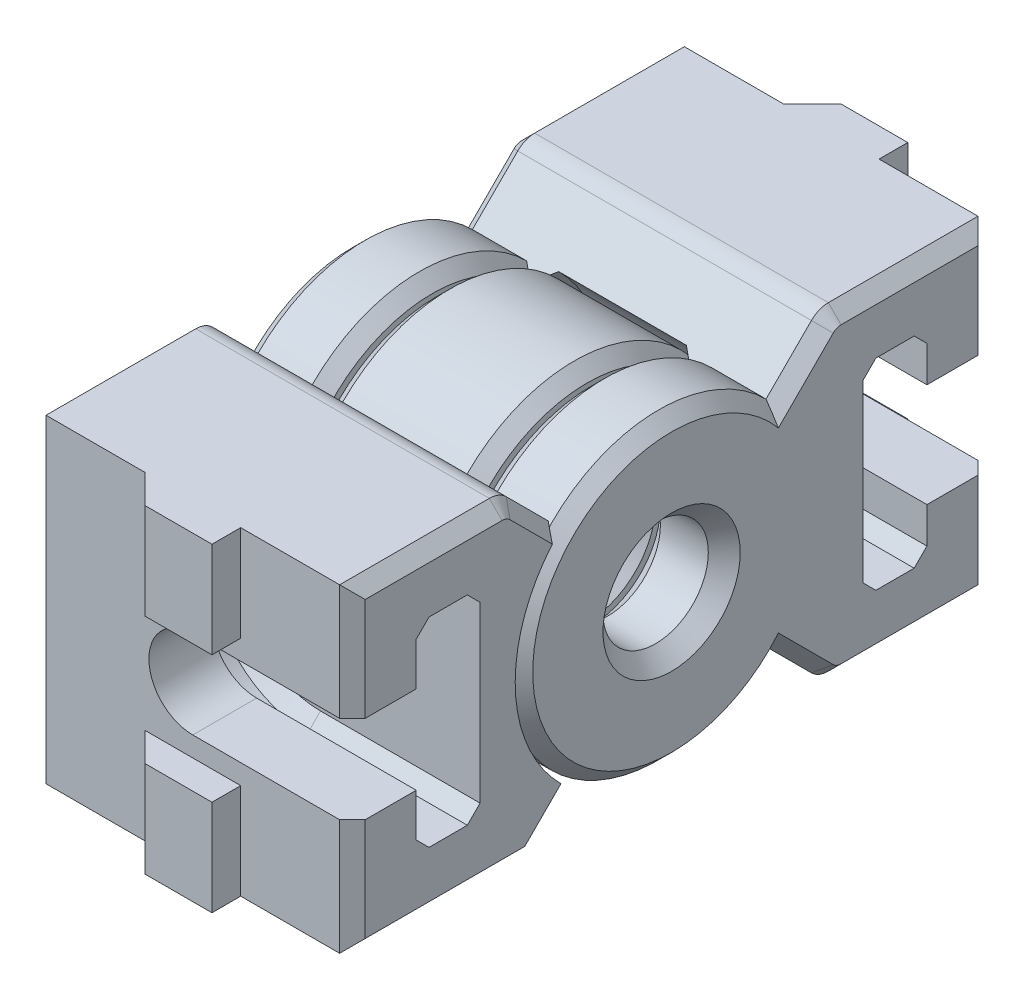
from build123d import *
from build123d.topology import SkipClean

# Parameters (mm, degrees)
SK_CYLINDER_W        = 20
SK_CYLINDER_H        = 6.2
BOSS_FIXEDSIDE_DEPTH = 10
SK_GAP_VERTICAL_W    = 10
SK_GAP_VERTICAL_H    = 0.3
SK_GAP_VERTICAL_W_2  = 5.3
GAPS_VERTICAL_ANGLE  = 180
SK_GAP_HORIZONTAL_W  = 0.3
SK_GAP_HORIZONTAL_H  = 9.8
CHAMF_ARMS_EXT_SIZE  = 1
CHAMF_ARMS_INT_SIZE  = 1
SK_BODYFIXED_W       = 5.715659497
SK_BODYFIXED_H       = 20
BODY_FIXED_DEPTH     = 10
FILLET_VERT_R        = 1.5
CHAMF_FACES1_SIZE    = 0.8
TAB_F_DEPTH          = 5
CHAMF_BODY_F_ANGLE   = 270
CHAMF_BODY_P_SIZE    = 0.8
CHAMF_F2_SIZE        = 1
CHAMF_P2_SIZE        = 1
SK_BODY_P_W          = 20
SK_BODY_P_H          = 5.715659497
PIVOT_BODY_DEPTH     = 10
FILLET_VERT2_R       = 1.5
TAB_P_DEPTH          = 6
CHAMF_FACES_SIZE     = 0.8
ACCESS_F_DEPTH       = 10
ACCESS_P_DEPTH       = 10
CHAMF_SCREW_F_SIZE   = 0.8
CHAMF_SCREW_P_SIZE   = 0.8
VERSION_NO_START     = -0.5
VERSION_NO_DEPTH     = 0.5
LABEL_S_DEPTH        = 0.5


with BuildPart() as part:
    # sk_cylinder → cylinder1 (revolve)
    with BuildSketch(Plane.XY, mode=Mode.PRIVATE) as cylinder1_sk:
        with Locations((0, 6.4)):
            Rectangle(SK_CYLINDER_W, SK_CYLINDER_H)
    revolve(cylinder1_sk.sketch.rotate(Axis((38.374012803, 0, 0), (-1, 0, 0)), 90), axis=Axis((38.374012803, 0, 0), (-1, 0, 0)))

    # sk_boss → Boss_fixedSide (add, symmetric)
    with BuildSketch(Plane(origin=(0, 0, 0), x_dir=(0, 0, -1), z_dir=(1, 0, 0))):
        with BuildLine():
            Line((-10, 10), (-14.284340503, 10))
            Line((-14.284340503, 10), (-14.284340503, -10))
            Line((-14.284340503, -10), (-10, -10))
            Line((-10, -10), (-6.717514421, -6.717514421))
            ThreePointArc((-6.717514421, -6.717514421), (-9.5, 0), (-6.717514421, 6.717514421))
            Line((-6.717514421, 6.717514421), (-10, 10))
        make_face()
    boss_fixedside = extrude(amount=BOSS_FIXEDSIDE_DEPTH, both=True)

    # Mirror1: Boss_fixedSide across plane
    add(boss_fixedside.mirror(Plane.XY))

    # sk_gap_vertical → gaps_vertical (revolve, symmetric, cut)
    with SkipClean():  # the faces are left unmerged after this step: merging them gives an invalid solid
        with BuildSketch(Plane(origin=(0, 0, 0), x_dir=(1, 0, 0), z_dir=(0, 1, 0))) as gaps_vertical_sk:
            with Locations((0, 9.65)):
                Rectangle(SK_GAP_VERTICAL_W, SK_GAP_VERTICAL_H)
            with Locations((-7.35, -9.65)):
                Rectangle(SK_GAP_VERTICAL_W_2, SK_GAP_VERTICAL_H)
            with Locations((7.35, -9.65)):
                Rectangle(SK_GAP_VERTICAL_W_2, SK_GAP_VERTICAL_H)
        revolve(axis=Axis((38.374012803, 0, 0), (-1, 0, 0)), revolution_arc=GAPS_VERTICAL_ANGLE / 2, mode=Mode.SUBTRACT)
        revolve(gaps_vertical_sk.sketch, axis=Axis((38.374012803, 0, 0), (1, 0, 0)), revolution_arc=GAPS_VERTICAL_ANGLE / 2, mode=Mode.SUBTRACT)
    add(part.part.scale(1), mode=Mode.REPLACE)  # the faces are merged on a copy

    # sk_gap_horizontal → gaps_horizontal (revolve, cut)
    with BuildSketch(Plane(origin=(0, 0, 0), x_dir=(1, 0, 0), z_dir=(0, 1, 0))):
        with Locations((-4.85, 4.9)):
            Rectangle(SK_GAP_HORIZONTAL_W, SK_GAP_HORIZONTAL_H)
        with Locations((4.85, 4.9)):
            Rectangle(SK_GAP_HORIZONTAL_W, SK_GAP_HORIZONTAL_H)
    revolve(axis=Axis((38.374012803, 0, 0), (-1, 0, 0)), mode=Mode.SUBTRACT)


with BuildPart() as gaps_horizontal_piece_1:
    # of the separate pieces the step leaves, piece 1, a body of its own (gaps_horizontal_pieces)
    add(part.part.solids().sort_by_distance((-10, 6.717514421, -6.717514421))[0])

    # chamf_arms_ext
    chamf_arms_ext_edges = [gaps_horizontal_piece_1.edges().sort_by_distance(p)[0] for p in [
        (-5, 0, 3.3),
        (5, 0, 3.3),
        (10, 0, 3.3),
        (-10, 0, 3.3),
    ]]
    chamfer(chamf_arms_ext_edges, length=CHAMF_ARMS_EXT_SIZE)

    # sk_bodyFixed → body_fixed (add, symmetric)
    with BuildSketch(Plane(origin=(0, 0, 0), x_dir=(0, 0, -1), z_dir=(1, 0, 0))):
        with Locations((17.142170252, 0)):
            Rectangle(SK_BODYFIXED_W, SK_BODYFIXED_H)
    extrude(amount=BODY_FIXED_DEPTH, both=True)

    # fillet_vert
    fillet_vert_edges = [gaps_horizontal_piece_1.edges().sort_by_distance(p)[0] for p in [
        (0, 10, -10),
        (0, -10, -10),
    ]]
    fillet(fillet_vert_edges, radius=FILLET_VERT_R)

    # chamf_faces1
    chamf_faces1_edges = [gaps_horizontal_piece_1.edges().sort_by_distance(p)[0] for p in [
        (-10, 0, 9.5),
        (10, 0, 9.5),
        (10, 0, -20),
        (-10, 0, -20),
        (-10, 10, -15.310660172),
        (-10, -8.139087297, -8.139087297),
        (-10, 9.885819299, -10.047295195),
        (-10, -9.885819299, -10.047295195),
        (10, -8.139087297, -8.139087297),
        (10, 10, -15.310660172),
        (10, 9.885819299, -10.047295195),
        (10, -9.885819299, -10.047295195),
        (10, 8.139087297, -8.139087297),
        (10, -10, -15.310660172),
        (-10, 8.139087297, -8.139087297),
        (-10, -10, -15.310660172),
    ]]
    chamfer(chamf_faces1_edges, length=CHAMF_FACES1_SIZE)

    # Sketch1 → tab_f (add)
    with BuildSketch(Plane.XZ.offset(10)):
        Polygon((-3, -20), (-1.2, -21.8), (3, -21.8), (3, -20), align=None)
    tab_f = extrude(amount=-TAB_F_DEPTH)

    # tab_f_mirror: tab_f across plane
    add(tab_f.mirror(Plane.ZX))

    # chamf_body_f: read off the stored shape, not the designer's step
    # chamf_body_f outline → chamf_body_f (revolve, cut)
    with BuildSketch(Plane(origin=(0, 0, 0), x_dir=(0, 0.7071067811865454, -0.7071067811865497), z_dir=(0, -0.7071067811865497, -0.7071067811865454))):
        Polygon((9.5, 5.8), (8.7, 5), (9.5, 5), align=None)
        Polygon((9.5, -5), (8.7, -5), (9.5, -5.8), align=None)
    revolve(axis=Axis((0, 0, 0), (1, 0, 0)), revolution_arc=CHAMF_BODY_F_ANGLE, mode=Mode.SUBTRACT)

    # chamf_f2
    chamf_f2_edges = [gaps_horizontal_piece_1.edges().sort_by_distance(p)[0] for p in [
        (-5, 0, -9.8),
        (5, 0, -9.8),
    ]]
    chamfer(chamf_f2_edges, length=CHAMF_F2_SIZE)

    # sk_screw_f → screw_position_f (revolve, cut)
    with BuildSketch(Plane(origin=(0, 0, 0), x_dir=(1, 0, 0), z_dir=(0, 1, 0))):
        Polygon((-6.3, 12), (-6.3, 16), (-3.25, 16), (-3.25, 20), (0, 20), (0, 6.929646456), (-3.25, 6.929646456), (-3.25, 12), align=None)
    revolve(axis=Axis((0, 0, -6.929646456), (0, 0, 1)), mode=Mode.SUBTRACT)

    # sk_access_f → access_f (cut)
    with BuildSketch(Plane(origin=(10, 0, 0), x_dir=(0, 0, -1), z_dir=(1, 0, 0))):
        Polygon((12, -6.3), (12, 6.3), (16, 6.3), (16, 3.25), (20, 3.25), (20, -3.25), (16, -3.25), (16, -6.3), align=None)
    extrude(amount=-ACCESS_F_DEPTH, mode=Mode.SUBTRACT)

    # chamf_screw_f
    chamf_screw_f_edges = [gaps_horizontal_piece_1.edges().sort_by_distance(p)[0] for p in [
        (-6.3, 0, -12),
        (-6.3, 0, -16),
        (5, -6.3, -12),
        (5, 6.3, -16),
        (5, -6.3, -16),
        (5, 6.3, -12),
    ]]
    chamfer(chamf_screw_f_edges, length=CHAMF_SCREW_F_SIZE)

    # version_no.: read off the stored shape, not the designer's step
    # version_no. outline → version_no. (cut)
    with BuildSketch(Plane.XZ.offset(10).offset(VERSION_NO_START)):
        with BuildLine():
            add(Edge.make_bspline(
                [(0.728894341, -12.596078837), (0.715015516, -12.581926087), (0.687675892, -12.554046865), (0.635420068, -12.526463187), (0.578656263, -12.506653104), (0.537990084, -12.50466895), (0.517073171, -12.503648387)],
                knots=[0, 0, 0, 0, 0.248427338, 0.489372123, 0.737355232, 1, 1, 1, 1], degree=3))
            add(Edge.make_bspline(
                [(0.517073171, -12.503648387), (0.496201396, -12.505287993), (0.455786308, -12.508462847), (0.398427073, -12.526431382), (0.345924672, -12.553080079), (0.30146236, -12.591691023), (0.262825354, -12.636157632), (0.236275362, -12.688668854), (0.217939005, -12.745945425), (0.215758894, -12.786423664), (0.214634146, -12.807306924)],
                knots=[0, 0, 0, 0, 0.131627538, 0.254877163, 0.376408939, 0.500137411, 0.623865884, 0.74539766, 0.868647285, 1, 1, 1, 1], degree=3))
            add(Edge.make_bspline(
                [(0.214634146, -12.807306924), (0.21663628, -12.829017672), (0.220486076, -12.870764095), (0.239954927, -12.929599084), (0.267223554, -12.983100659), (0.293998064, -13.012295909), (0.307317073, -13.026819119)],
                knots=[0, 0, 0, 0, 0.267527836, 0.514414795, 0.758445115, 1, 1, 1, 1], degree=3))
            Line((0.307317073, -13.026819119), (1.019668207, -13.721657629))
            Line((1.019668207, -13.721657629), (-3.692393531, -13.721657629))
            add(Edge.make_bspline(
                [(-3.692393531, -13.721657629), (-3.713296755, -13.723585403), (-3.753558882, -13.72729853), (-3.811976127, -13.742789006), (-3.863008767, -13.771854396), (-3.908798716, -13.808533389), (-3.946456472, -13.853143258), (-3.973616818, -13.904405627), (-3.991512945, -13.960647842), (-3.994696781, -14.000259338), (-3.996341463, -14.020721558)],
                knots=[0, 0, 0, 0, 0.133295613, 0.256743408, 0.380407114, 0.503421946, 0.628079383, 0.748241946, 0.869948653, 1, 1, 1, 1], degree=3))
            add(Edge.make_bspline(
                [(-3.996341463, -14.020721558), (-3.994646481, -14.041169803), (-3.991333105, -14.081142343), (-3.973892382, -14.137931041), (-3.946445639, -14.189545854), (-3.908744416, -14.233998299), (-3.863382567, -14.271175), (-3.811379628, -14.297929166), (-3.754028546, -14.316178679), (-3.713560782, -14.318370999), (-3.692682927, -14.319502045)],
                knots=[0, 0, 0, 0, 0.129918916, 0.253967463, 0.374007664, 0.498538163, 0.62142773, 0.743747292, 0.867795838, 1, 1, 1, 1], degree=3))
            Line((-3.692682927, -14.319502045), (1.704336176, -14.319502045))
            add(Edge.make_bspline(
                [(1.704336176, -14.319502045), (1.724571905, -14.318313578), (1.764386475, -14.315975223), (1.82115467, -14.297947294), (1.873066816, -14.271113814), (1.91856943, -14.234391417), (1.954882111, -14.189116378), (1.982417102, -14.137977638), (2.000148635, -14.081204649), (2.002471513, -14.041176508), (2.003658537, -14.020721558)],
                knots=[0, 0, 0, 0, 0.128973592, 0.253760461, 0.376808055, 0.500429045, 0.624050036, 0.744804702, 0.869591571, 1, 1, 1, 1], degree=3))
            add(Edge.make_bspline(
                [(2.003658537, -14.020721558), (2.002471227, -14.000272153), (2.000170374, -13.960643822), (1.982683601, -13.904101424), (1.9527966, -13.854361013), (1.925803172, -13.827131534), (1.912195122, -13.813404484)],
                knots=[0, 0, 0, 0, 0.262469972, 0.508633219, 0.752289931, 1, 1, 1, 1], degree=3))
            Line((1.912195122, -13.813404484), (0.728894341, -12.596078837))
        make_face()
    extrude(amount=VERSION_NO_DEPTH, mode=Mode.SUBTRACT)


with BuildPart() as gaps_horizontal_piece_2:
    # of the separate pieces the step leaves, piece 2, a body of its own (gaps_horizontal_pieces)
    add(part.part.solids().sort_by_distance((4.7, -6.717514421, 6.717514421))[0])

    # chamf_arms_int
    chamf_arms_int_edges = [gaps_horizontal_piece_2.edges().sort_by_distance(p)[0] for p in [
        (4.7, 0, 3.3),
        (-4.7, 0, 3.3),
    ]]
    chamfer(chamf_arms_int_edges, length=CHAMF_ARMS_INT_SIZE)

    # chamf_body_p
    chamf_body_p_edges = [gaps_horizontal_piece_2.edges().sort_by_distance(p)[0] for p in [
        (4.7, 0, -9.5),
        (-4.7, 0, -9.5),
    ]]
    chamfer(chamf_body_p_edges, length=CHAMF_BODY_P_SIZE)

    # chamf_p2
    chamf_p2_edges = [gaps_horizontal_piece_2.edges().sort_by_distance(p)[0] for p in [
        (-4.7, 0, 9.8),
        (4.7, 0, 9.8),
    ]]
    chamfer(chamf_p2_edges, length=CHAMF_P2_SIZE)

    # sk_body_p → pivot_body (add, symmetric)
    with BuildSketch(Plane(origin=(0, 0, 0), x_dir=(0, -1, 0), z_dir=(1, 0, 0))):
        with Locations((0, -17.142170252)):
            Rectangle(SK_BODY_P_W, SK_BODY_P_H)
    extrude(amount=PIVOT_BODY_DEPTH, both=True)

    # fillet_vert2
    fillet_vert2_edges = [gaps_horizontal_piece_2.edges().sort_by_distance(p)[0] for p in [
        (0, 10, 10),
    ]]
    fillet(fillet_vert2_edges, radius=FILLET_VERT2_R)

    # Sketch2 → tab_p (add)
    with BuildSketch(Plane(origin=(0, 10, 0), x_dir=(1, 0, 0), z_dir=(0, 1, 0))):
        Polygon((-3, -20), (-1.2, -21.8), (3, -21.8), (3, -20), align=None)
    tab_p = extrude(amount=-TAB_P_DEPTH)

    # tab_p_mirror: tab_p across plane
    add(tab_p.mirror(Plane.ZX))

    # chamf_faces
    chamf_faces_edges = [gaps_horizontal_piece_2.edges().sort_by_distance(p)[0] for p in [
        (10, 8.245153314, 8.245153314),
        (10, -10, 15),
        (-10, 8.245153314, 8.245153314),
        (-10, -10, 15),
        (-10, 0, 20),
        (10, 0, 20),
        (-10, 10, 15.310660172),
        (10, 10, 15.310660172),
        (-10, 9.885819299, 10.047295195),
        (10, 9.885819299, 10.047295195),
    ]]
    chamfer(chamf_faces_edges, length=CHAMF_FACES_SIZE)

    # sk_screw_p → screw_position_p (revolve, cut)
    with BuildSketch(Plane(origin=(0, 0, 0), x_dir=(1, 0, 0), z_dir=(0, 1, 0))):
        Polygon((0, -20), (2.75, -20), (2.75, -16), (6.25, -16), (6.25, -12), (2.75, -12), (2.75, 9.5), (0, 9.5), align=None)
    revolve(axis=Axis((0, 0, 20), (0, 0, -1)), mode=Mode.SUBTRACT)

    # sk_access_p → access_p (cut)
    with BuildSketch(Plane(origin=(10, 0, 0), x_dir=(0, 0, -1), z_dir=(1, 0, 0))):
        Polygon((-16, 6.25), (-12, 6.25), (-12, -6.25), (-16, -6.25), (-16, -2.75), (-20, -2.75), (-20, 2.75), (-16, 2.75), align=None)
    extrude(amount=-ACCESS_P_DEPTH, mode=Mode.SUBTRACT)

    # chamf_screw_p
    chamf_screw_p_edges = [gaps_horizontal_piece_2.edges().sort_by_distance(p)[0] for p in [
        (-6.25, 0, 12),
        (-6.25, 0, 16),
        (5, 6.25, 12),
        (5, -6.25, 16),
        (5, 6.25, 16),
        (5, -6.25, 12),
    ]]
    chamfer(chamf_screw_p_edges, length=CHAMF_SCREW_P_SIZE)

    # sk_label_s → label_s (cut)
    with BuildSketch(Plane.XZ.offset(10)):
        with BuildLine():
            add(Edge.make_bspline(
                [(-2.575431117, 14.467975896), (-2.598580421, 14.430201348), (-2.641948983, 14.359433442), (-2.73066977, 14.276797193), (-2.834391554, 14.226435487), (-2.908831505, 14.218588306), (-2.946341463, 14.214634146)],
                knots=[0, 0, 0, 0, 1.123938789, 2.105618746, 3.045429761, 4, 4, 4, 4], degree=3))
            add(Edge.make_bspline(
                [(-2.946341463, 14.214634146), (-2.97674995, 14.217604816), (-3.037425337, 14.223532324), (-3.12310405, 14.25953539), (-3.200787276, 14.315398692), (-3.269421871, 14.389667024), (-3.326224726, 14.479457499), (-3.367805345, 14.581504229), (-3.395480399, 14.693713498), (-3.400066049, 14.772595095), (-3.402439024, 14.813414634)],
                knots=[0, 0, 0, 0, 0.881126015, 1.758149344, 2.653564188, 3.636843178, 4.669324744, 5.714823401, 6.817469971, 8, 8, 8, 8], degree=3))
            add(Edge.make_bspline(
                [(-3.402439024, 14.813414634), (-3.397628227, 14.935602519), (-3.388103967, 15.177506113), (-3.330274245, 15.532130843), (-3.248870935, 15.876363598), (-3.165842979, 16.094667575), (-3.124390244, 16.203658537)],
                knots=[0, 0, 0, 0, 1.028397128, 2.03598713, 3.019442272, 4, 4, 4, 4], degree=3))
            add(Edge.make_bspline(
                [(-3.124390244, 16.203658537), (-3.116772158, 16.222113011), (-3.101138475, 16.259984913), (-3.099579695, 16.300948595), (-3.098780488, 16.32195122)],
                knots=[0, 0, 0, 0, 0.974573408, 2, 2, 2, 2], degree=3))
            add(Edge.make_bspline(
                [(-3.098780488, 16.32195122), (-3.100049052, 16.342788682), (-3.102500952, 16.383063651), (-3.118787034, 16.44086552), (-3.14598996, 16.492629444), (-3.183056694, 16.537982628), (-3.227720585, 16.576091029), (-3.280433927, 16.603111081), (-3.339150078, 16.620873336), (-3.38076046, 16.623987375), (-3.402439024, 16.625609756)],
                knots=[0, 0, 0, 0, 1.045390934, 2.020547774, 2.987777248, 3.959513973, 4.944226197, 5.911455671, 6.911890745, 8, 8, 8, 8], degree=3))
            add(Edge.make_bspline(
                [(-3.402439024, 16.625609756), (-3.433505822, 16.62191574), (-3.492621516, 16.614886552), (-3.570406731, 16.572593895), (-3.633845865, 16.512139489), (-3.65891549, 16.459222925), (-3.67195122, 16.431707317)],
                knots=[0, 0, 0, 0, 1.059380328, 2.01585002, 2.968279695, 4, 4, 4, 4], degree=3))
            add(Edge.make_bspline(
                [(-3.67195122, 16.431707317), (-3.698174257, 16.368534703), (-3.750473544, 16.242543098), (-3.818030134, 16.048980062), (-3.873338193, 15.85160429), (-3.920602881, 15.650803727), (-3.9552629, 15.446229613), (-3.980883927, 15.238308544), (-3.997561761, 15.027102329), (-3.999183298, 14.884990498), (-4, 14.813414634)],
                knots=[0, 0, 0, 0, 0.987040213, 1.968555252, 2.956553969, 3.944204247, 4.944407887, 5.949349252, 6.967171844, 8, 8, 8, 8], degree=3))
            add(Edge.make_bspline(
                [(-4, 14.813414634), (-3.998184801, 14.771499569), (-3.994630338, 14.689422881), (-3.978784213, 14.568983893), (-3.952892058, 14.45408007), (-3.918984806, 14.344234081), (-3.876127934, 14.239528351), (-3.823608137, 14.140819267), (-3.762062715, 14.0475566), (-3.692875386, 13.960094013), (-3.61701543, 13.879886149), (-3.534599334, 13.810517837), (-3.44898587, 13.749261638), (-3.356988153, 13.701145185), (-3.261165715, 13.661532877), (-3.160700092, 13.632034983), (-3.055098403, 13.61366578), (-2.982996235, 13.609456802), (-2.946341463, 13.607317073)],
                knots=[0, 0, 0, 0, 1.133777999, 2.220126432, 3.278548706, 4.314309499, 5.3244541, 6.33220499, 7.331895187, 8.341023155, 9.343668435, 10.310319102, 11.249277535, 12.183336124, 13.109800879, 14.048695006, 15.008009869, 16, 16, 16, 16], degree=3))
            add(Edge.make_bspline(
                [(-2.946341463, 13.607317073), (-2.89937504, 13.609367574), (-2.806387072, 13.613427324), (-2.671483247, 13.64769812), (-2.541414029, 13.695245152), (-2.421231778, 13.766478707), (-2.308899856, 13.851069634), (-2.208908987, 13.951293978), (-2.117681231, 14.062537364), (-2.069583744, 14.146382024), (-2.045121951, 14.18902439)],
                knots=[0, 0, 0, 0, 0.999532331, 1.978955873, 2.95257429, 3.942444701, 4.944153112, 5.942896383, 6.953782308, 8, 8, 8, 8], degree=3))
            Line((-2.045121951, 14.18902439), (-1.201438643, 15.766103754))
            add(Edge.make_bspline(
                [(-1.201438643, 15.766103754), (-1.1795695, 15.803528643), (-1.138312739, 15.87413176), (-1.051253012, 15.955609367), (-0.94954998, 16.006736819), (-0.87617043, 16.014408926), (-0.83902439, 16.018292683)],
                knots=[0, 0, 0, 0, 1.115947942, 2.105267483, 3.040852529, 4, 4, 4, 4], degree=3))
            add(Edge.make_bspline(
                [(-0.83902439, 16.018292683), (-0.80786894, 16.015213982), (-0.746274231, 16.009127352), (-0.658205348, 15.975395852), (-0.581459205, 15.917545436), (-0.51332586, 15.843303716), (-0.458195173, 15.753069613), (-0.415980055, 15.651646224), (-0.39003106, 15.539065042), (-0.386154132, 15.460302097), (-0.384146341, 15.419512195)],
                knots=[0, 0, 0, 0, 0.902309758, 1.783877549, 2.684042595, 3.65702988, 4.680837105, 5.723882474, 6.821239962, 8, 8, 8, 8], degree=3))
            add(Edge.make_bspline(
                [(-0.384146341, 15.419512195), (-0.387998614, 15.323768513), (-0.39557335, 15.135507394), (-0.445334071, 14.860541561), (-0.526043988, 14.599319014), (-0.605560478, 14.437717788), (-0.645121951, 14.357317073)],
                knots=[0, 0, 0, 0, 1.040210352, 2.04536907, 3.027521465, 4, 4, 4, 4], degree=3))
            add(Edge.make_bspline(
                [(-0.645121951, 14.357317073), (-0.653918028, 14.352733523), (-0.67151018, 14.343566423), (-0.68645723, 14.316196593), (-0.69892216, 14.285270307), (-0.698830105, 14.261559989), (-0.698780488, 14.248780488)],
                knots=[0, 0, 0, 0, 0.905758236, 1.811516472, 2.820440602, 4, 4, 4, 4], degree=3))
            add(Edge.make_bspline(
                [(-0.698780488, 14.248780488), (-0.698234165, 14.227595025), (-0.697171331, 14.186380116), (-0.684430439, 14.126851032), (-0.657654918, 14.074223583), (-0.620908832, 14.029132325), (-0.575822602, 13.992135441), (-0.523453717, 13.966628921), (-0.465641777, 13.949852396), (-0.424921773, 13.947545882), (-0.403658537, 13.946341463)],
                knots=[0, 0, 0, 0, 1.066921594, 2.075624983, 3.037485073, 4.013204285, 4.988923497, 5.950783587, 6.929936929, 8, 8, 8, 8], degree=3))
            add(Edge.make_bspline(
                [(-0.403658537, 13.946341463), (-0.374061695, 13.948883131), (-0.318153438, 13.953684326), (-0.242103376, 13.984325388), (-0.178736341, 14.031234508), (-0.15234861, 14.07530701), (-0.13902439, 14.097560976)],
                knots=[0, 0, 0, 0, 1.107392845, 2.091858464, 3.036503139, 4, 4, 4, 4], degree=3))
            add(Edge.make_bspline(
                [(-0.13902439, 14.097560976), (-0.112258377, 14.148009899), (-0.058938922, 14.248507087), (0.00754095, 14.405492996), (0.064958955, 14.565096712), (0.112573774, 14.727596302), (0.150688107, 14.893289457), (0.178715065, 15.062266083), (0.195944397, 15.234617005), (0.199455255, 15.350369334), (0.201219512, 15.408536585)],
                knots=[0, 0, 0, 0, 1.001520086, 1.995086214, 2.987653616, 3.976113116, 4.963954958, 5.968745302, 6.979264589, 8, 8, 8, 8], degree=3))
            add(Edge.make_bspline(
                [(0.201219512, 15.408536585), (0.199399942, 15.448829585), (0.195803096, 15.528478988), (0.179784338, 15.645130827), (0.15539244, 15.757405619), (0.121747206, 15.864677645), (0.076842129, 15.9660005), (0.025963513, 16.063419537), (-0.035485134, 16.155288197), (-0.106002539, 16.240759055), (-0.181718647, 16.320212385), (-0.264678236, 16.388650186), (-0.350873932, 16.44907297), (-0.442986707, 16.498264147), (-0.540736479, 16.535880692), (-0.642576179, 16.565447492), (-0.749790021, 16.583896679), (-0.822696695, 16.58810484), (-0.859756098, 16.590243902)],
                knots=[0, 0, 0, 0, 1.098795587, 2.172050066, 3.204265739, 4.227344731, 5.229638228, 6.220849516, 7.219462609, 8.23513683, 9.237981224, 10.205379914, 11.161099318, 12.102781812, 13.042964239, 14.010806879, 14.988867496, 16, 16, 16, 16], degree=3))
            add(Edge.make_bspline(
                [(-0.859756098, 16.590243902), (-0.905452664, 16.58752889), (-0.995408268, 16.582184274), (-1.127631607, 16.550572327), (-1.253105406, 16.498997419), (-1.372139382, 16.429074854), (-1.480594037, 16.342183309), (-1.580729464, 16.243977259), (-1.66936452, 16.132805937), (-1.717262125, 16.050249827), (-1.741463415, 16.008536585)],
                knots=[0, 0, 0, 0, 0.990571617, 1.949981724, 2.929880336, 3.921000203, 4.930852468, 5.933764616, 6.955990362, 8, 8, 8, 8], degree=3))
            Line((-1.741463415, 16.008536585), (-2.575431117, 14.467975896))
        make_face()
    extrude(amount=-LABEL_S_DEPTH, mode=Mode.SUBTRACT)


solid = Compound([gaps_horizontal_piece_1.part, gaps_horizontal_piece_2.part])
